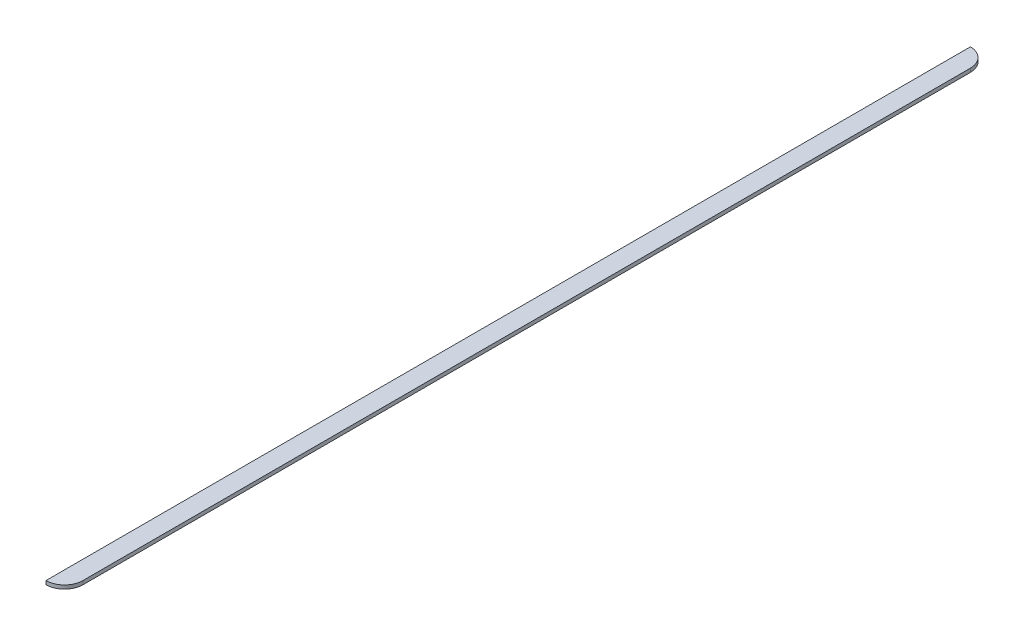
from build123d import *

# Parameters (mm, degrees)
SKETCH_1_W      = 10
SKETCH_1_H      = 2
EXTRUDE_1_DEPTH = 250
FILLET_1_R      = 10


with BuildPart() as part:
    # 草图1 → 凸台-拉伸1 (new, symmetric)
    with BuildSketch(Plane.XY):
        with Locations((5, 1)):
            Rectangle(SKETCH_1_W, SKETCH_1_H)
    extrude(amount=EXTRUDE_1_DEPTH, both=True)

    # 圆角1
    fillet_1_edges = [part.edges().sort_by_distance(p)[0] for p in [
        (10, 1, -250),
        (10, 1, 250),
    ]]
    fillet(fillet_1_edges, radius=FILLET_1_R - 0.0001)  # a hair under: the kernel refuses the full size


solid = part.part
